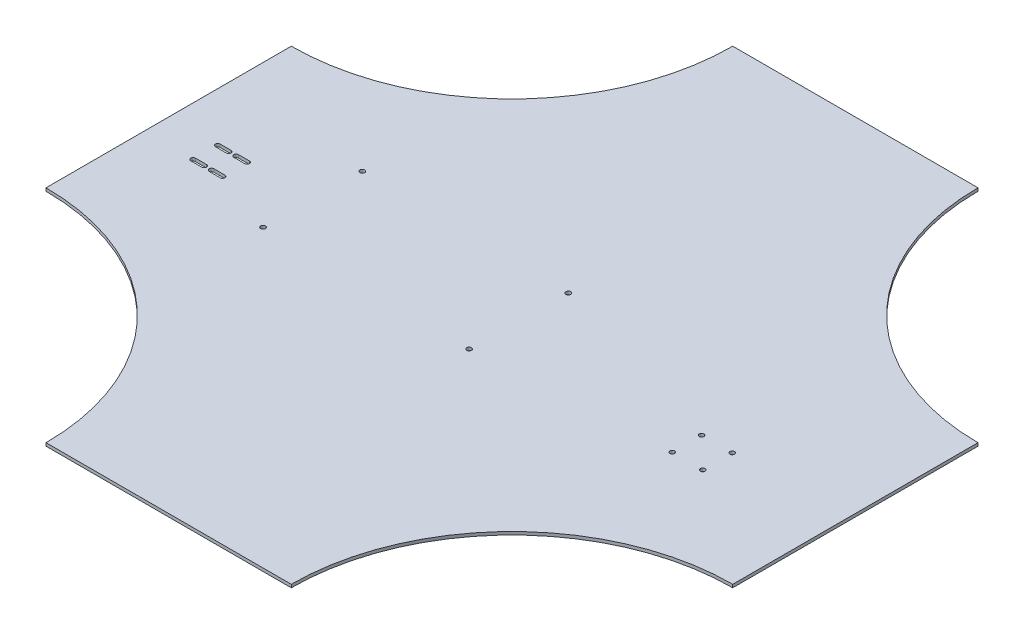
from build123d import *

# Parameters (mm, degrees)
BOSS_EXTRUDE1_DEPTH     = 3.175
CUT_EXTRUDE1_DEPTH      = 503.904365287
CUT_EXTRUDE1_DEPTH_BACK = 503.904365287
SKETCH4_R               = 2.413
CUT_EXTRUDE2_DEPTH      = 503.904365287
SKETCH5_R               = 2.5
SKETCH5_R_2             = 2.47796547
CUT_EXTRUDE3_DEPTH      = 503.904365287


with BuildPart() as part:
    # Sketch1 → Boss-Extrude1 (new body)
    with BuildSketch(Plane(origin=(0, 0, 0), x_dir=(1, 0, 0), z_dir=(0, 1, 0))):
        with BuildLine():
            Line((-127, -355.6), (127, -355.6))
            ThreePointArc((127, -355.6), (193.955389821, -193.955389821), (355.6, -127))
            Line((355.6, -127), (355.6, 127))
            ThreePointArc((355.6, 127), (193.955389821, 193.955389821), (127, 355.6))
            Line((127, 355.6), (-127, 355.6))
            ThreePointArc((-127, 355.6), (-193.955389821, 193.955389821), (-355.6, 127))
            Line((-355.6, 127), (-355.6, -127))
            ThreePointArc((-355.6, -127), (-193.955389821, -193.955389821), (-127, -355.6))
        make_face()
    extrude(amount=BOSS_EXTRUDE1_DEPTH)

    # Sketch2 → Cut-Extrude1 (cut, two sides: drawn at the far end of the back side and taken through both)
    with BuildSketch(Plane(origin=(0, 3.175, 0), x_dir=(1, 0, 0), z_dir=(0, 1, 0)).offset(-CUT_EXTRUDE1_DEPTH_BACK)):
        with BuildLine():
            Line((-304.8, 2.413), (-293.37, 2.413))
            ThreePointArc((-293.37, 2.413), (-290.957, 0), (-293.37, -2.413))
            Line((-293.37, -2.413), (-304.8, -2.413))
            ThreePointArc((-304.8, -2.413), (-307.213, 0), (-304.8, 2.413))
        make_face()
        with BuildLine():
            Line((-304.8, -22.987), (-293.37, -22.987))
            ThreePointArc((-293.37, -22.987), (-290.957, -25.4), (-293.37, -27.813))
            Line((-293.37, -27.813), (-304.8, -27.813))
            ThreePointArc((-304.8, -27.813), (-307.213, -25.4), (-304.8, -22.987))
        make_face()
        with BuildLine():
            Line((-285.75, -2.413), (-274.32, -2.413))
            ThreePointArc((-274.32, -2.413), (-271.907, 0), (-274.32, 2.413))
            Line((-274.32, 2.413), (-285.75, 2.413))
            ThreePointArc((-285.75, 2.413), (-288.163, 0), (-285.75, -2.413))
        make_face()
        with BuildLine():
            Line((-285.75, -22.987), (-274.32, -22.987))
            ThreePointArc((-274.32, -22.987), (-271.907, -25.4), (-274.32, -27.813))
            Line((-274.32, -27.813), (-285.75, -27.813))
            ThreePointArc((-285.75, -27.813), (-288.163, -25.4), (-285.75, -22.987))
        make_face()
    extrude(amount=CUT_EXTRUDE1_DEPTH + CUT_EXTRUDE1_DEPTH_BACK, mode=Mode.SUBTRACT)

    # Sketch4 → Cut-Extrude2 (cut, through all)
    with BuildSketch(Plane(origin=(0, 3.175, 0), x_dir=(1, 0, 0), z_dir=(0, 1, 0))):
        with Locations((237.49, -9.430177049)):
            Circle(SKETCH4_R)
        with Locations((205.74, -9.430177049)):
            Circle(SKETCH4_R)
        with Locations((237.49, -39.910177049)):
            Circle(SKETCH4_R)
        with Locations((205.74, -39.910177049)):
            Circle(SKETCH4_R)
    extrude(amount=-CUT_EXTRUDE2_DEPTH, mode=Mode.SUBTRACT)

    # Sketch5 → Cut-Extrude3 (cut, through all)
    with BuildSketch(Plane.XZ):
        with Locations((-207.790149601, 50.01656837)):
            Circle(SKETCH5_R)
        with Locations((-206.624048203, -51.576739518)):
            Circle(SKETCH5_R)
        with Locations((8.09562966, 52.494533839)):
            Circle(SKETCH5_R_2)
        with Locations((9.261731058, -49.098774048)):
            Circle(SKETCH5_R)
    extrude(amount=-CUT_EXTRUDE3_DEPTH, mode=Mode.SUBTRACT)


solid = part.part
